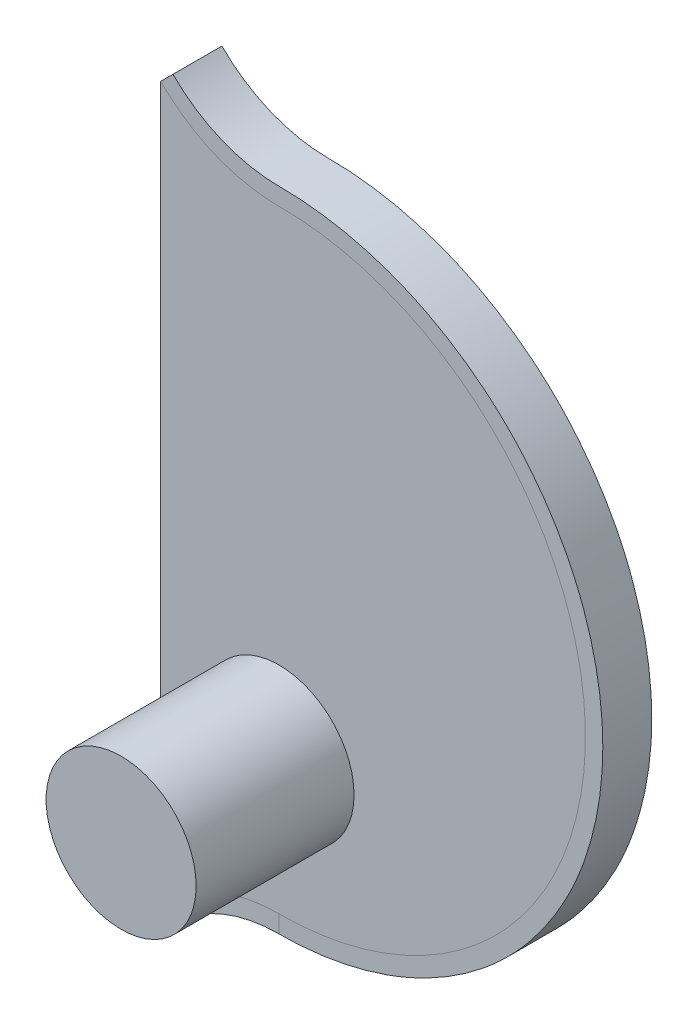
from build123d import *

# Parameters (mm, degrees)
SWEEP1_START             = -3.1
SWEEP1_DEPTH             = 6.2
BOSS_EXTRUDE6_DEPTH      = 6.2
BOSS_EXTRUDE7_DEPTH      = 20
BOSS_EXTRUDE7_DEPTH_BACK = 29.8
SKETCH4_R                = 9.5


# Read off the part's stored shape, not the designer's step: Sweep1
with BuildPart() as part:
    # Sweep1 outline → Sweep1 (new body)
    with BuildSketch(Plane.XY.offset(SWEEP1_START)):
        with BuildLine():
            Line((-14.990663761, -86.009336239), (-13.435028843, -87.564971157))
            ThreePointArc((-13.435028843, -87.564971157), (-7.270985215, -83.446288882), (0, -82))
            add(Edge.make_bspline(
                [(0, -82), (5.36776502, -82), (10.73166338, -80.932879693), (20.648378074, -76.825241973), (25.196415612, -73.786340445), (32.786340445, -66.196415612), (35.825241973, -61.648378074), (39.932879693, -51.73166338), (41, -46.366887318), (41, -35.633112682), (39.932879693, -30.26833662), (35.825241973, -20.351621926), (32.786340445, -15.803584388), (25.196415612, -8.213659555), (20.648378074, -5.174758027), (13.210842054, -2.094029737), (10.630715354, -1.311343271), (6.682697127, -0.526033619), (5.353840568, -0.328922129), (3.350967037, -0.131661816), (2.681744441, -0.082298868), (1.676704424, -0.032925818), (1.341489818, -0.020579417), (0.838512077, -0.00823224), (0.670826835, -0.005145218), (0.335428413, -0.001029098), (0.167715226, -3.229e-06), (-0.15544338, 2.993e-06), (-0.310883019, 0.001907653), (-0.621666013, 0.009536803), (-0.777009367, 0.015258306), (-1.242759619, 0.0381385), (-1.552887164, 0.061014012), (-2.481048068, 0.152427328), (-3.096859644, 0.243771677), (-4.926429066, 0.607695662), (-6.122097583, 0.970404043), (-9.568760479, 2.39805856), (-11.675791115, 3.80573343), (-13.435028843, 5.564971157)],
                knots=[0.094059406, 0.094059406, 0.094059406, 0.094059406, 0.195544554, 0.195544554, 0.297029703, 0.297029703, 0.398514851, 0.398514851, 0.5, 0.5, 0.601485149, 0.601485149, 0.702970297, 0.702970297, 0.804455446, 0.804455446, 0.85519802, 0.85519802, 0.880569307, 0.880569307, 0.89325495, 0.89325495, 0.899597772, 0.899597772, 0.902769183, 0.902769183, 0.905940594, 0.905940594, 0.90887995, 0.90887995, 0.911819307, 0.911819307, 0.91769802, 0.91769802, 0.929455446, 0.929455446, 0.952970297, 0.952970297, 1, 1, 1, 1], degree=3))
            Line((-13.435028843, 5.564971157), (-14.990663761, 4.009336239))
            add(Edge.make_bspline(
                [(0, -79.8), (5.079738604, -79.8), (10.155818028, -78.790139807), (19.540416323, -74.902911916), (23.844412823, -72.027073397), (31.027073397, -64.844412823), (33.902911916, -60.540416323), (37.790139807, -51.155818028), (38.8, -46.078907999), (38.8, -35.921092001), (37.790139807, -30.844181972), (33.902911916, -21.459583677), (31.027073397, -17.155587177), (23.844412823, -9.972926603), (19.540416323, -7.097088084), (12.501967602, -4.181667166), (10.060286725, -3.440978511), (6.324113379, -2.697807425), (5.066561318, -2.511272649), (3.17115905, -2.324597036), (2.537845958, -2.277882831), (1.586734919, -2.231159066), (1.269507438, -2.219475156), (0.793518746, -2.20779051), (0.634831249, -2.204869133), (0.317429815, -2.200973878), (0.172925378, -2.20000343), (-0.160272302, -2.199996821), (-0.34688, -2.197871461), (-0.693648394, -2.189358936), (-0.866978873, -2.182974943), (-1.386658101, -2.157445463), (-1.732695151, -2.131921207), (-2.768327318, -2.029923192), (-3.455443393, -1.928002128), (-5.496857695, -1.521939577), (-6.83097204, -1.117233383), (-10.676722219, 0.475728499), (-13.027724823, 2.046397301), (-14.990663761, 4.009336239)],
                knots=[0.094059406, 0.094059406, 0.094059406, 0.094059406, 0.195544554, 0.195544554, 0.297029703, 0.297029703, 0.398514851, 0.398514851, 0.5, 0.5, 0.601485149, 0.601485149, 0.702970297, 0.702970297, 0.804455446, 0.804455446, 0.85519802, 0.85519802, 0.880569307, 0.880569307, 0.89325495, 0.89325495, 0.899597772, 0.899597772, 0.902769183, 0.902769183, 0.905940594, 0.905940594, 0.90887995, 0.90887995, 0.911819307, 0.911819307, 0.91769802, 0.91769802, 0.929455446, 0.929455446, 0.952970297, 0.952970297, 1, 1, 1, 1], degree=3))
            ThreePointArc((0, -79.8), (-8.112888766, -81.413753911), (-14.990663761, -86.009336239))
        make_face()
    extrude(amount=SWEEP1_DEPTH)


with BuildPart() as body_2:
    # Sketch3 → Boss-Extrude6 (new body)
    with BuildSketch(Plane.XY.offset(3.1)):
        with BuildLine():
            Line((-14.990663761, 4.009336239), (-14.990663761, -86.009336239))
            ThreePointArc((-14.990663761, -86.009336239), (-8.112888766, -81.413753911), (0, -79.8))
            ThreePointArc((0, -79.8), (38.8, -41), (0, -2.2))
            ThreePointArc((0, -2.2), (-8.112888766, -0.586246089), (-14.990663761, 4.009336239))
        make_face()
    extrude(amount=-BOSS_EXTRUDE6_DEPTH)

    # Sketch4 → Boss-Extrude7 (add, two sides: drawn at the far end of the back side and taken through both)
    with BuildSketch(Plane.XY.offset(3.1).offset(-BOSS_EXTRUDE7_DEPTH_BACK)):
        with Locations((0, -62)):
            Circle(SKETCH4_R)
    extrude(amount=BOSS_EXTRUDE7_DEPTH + BOSS_EXTRUDE7_DEPTH_BACK)


solid = Compound([part.part, body_2.part])
